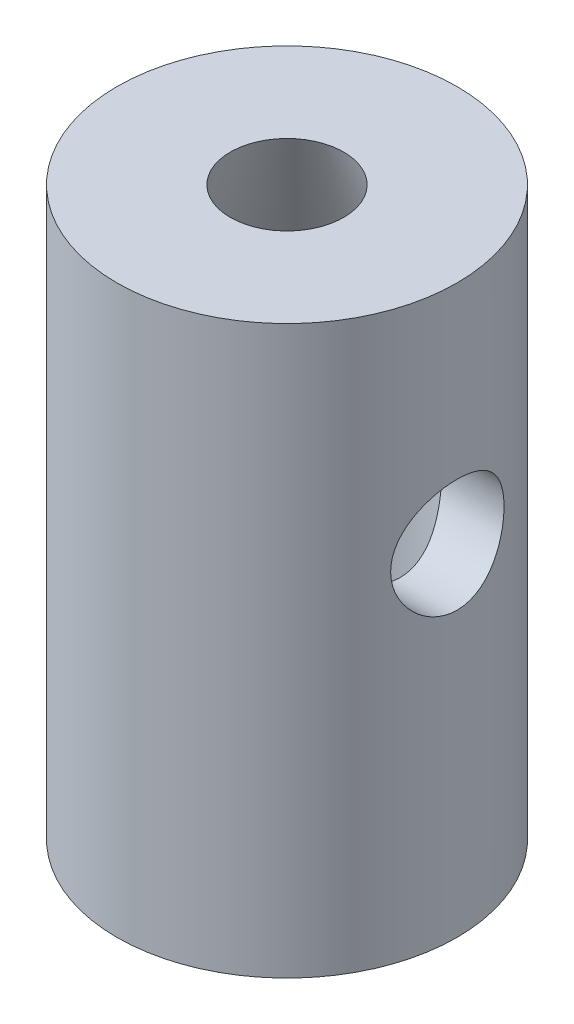
from build123d import *

# Parameters (mm, degrees)
SKETCH2_R          = 12.7
CUT_EXTRUDE1_DEPTH = 138.957312238


with BuildPart() as part:
    # Sketch1 → Revolve1 (revolve)
    with BuildSketch(Plane.XY):
        Polygon((12.7, 0), (38.1, 0), (38.1, -127), (25.4, -127), (25.4, -34.892963227), align=None)
    revolve(axis=Axis((0, 0, 0), (0, -1, 0)))

    # Sketch2 → Cut-Extrude1 (cut, through all)
    with BuildSketch(Plane(origin=(0, 0, 0), x_dir=(0, 0, -1), z_dir=(1, 0, 0))):
        with Locations((0, -50.8)):
            Circle(SKETCH2_R)
    extrude(amount=CUT_EXTRUDE1_DEPTH, mode=Mode.SUBTRACT)


solid = part.part
